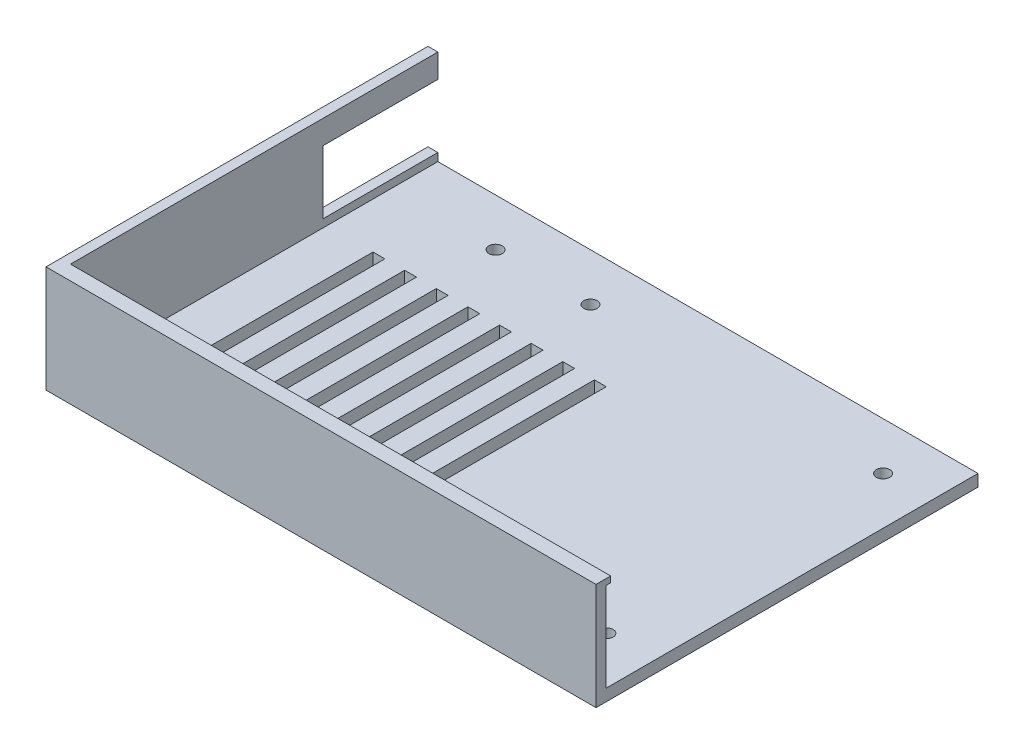
from build123d import *

# Parameters (mm, degrees)
SKETCH1_W                     = 278.2
SKETCH1_H                     = 193.2
SHELL_BLOCK_DEPTH             = 27
SKETCH2_W                     = 273.2
SKETCH2_H                     = 185.8
FRONT_OPENING_DEPTH           = 1.5
SKETCH3_W                     = 273.2
SKETCH3_H                     = 188.2
DISPLAY_POCKET_DEPTH          = 22.5
SKETCH4_W                     = 3
SKETCH4_H                     = 56
VENT_SLOTS_DEPTH              = 4
SKETCH5_W                     = 58
SKETCH5_H                     = 16
CABLE_EXIT_X_SHORT_SIDE_DEPTH = 140.1
SKETCH6_R                     = 1.7
BOLT_HOLES_DEPTH              = 4
KEEP_ONE_HALF_X_DEPTH         = 172.491603293
KEEP_ONE_HALF_X_DEPTH_BACK    = 172.491603293
SKETCH7_W                     = 200
SKETCH7_H                     = 400
KEEP_ONE_QUARTER_Z_DEPTH      = 172.491603293
KEEP_ONE_QUARTER_Z_DEPTH_BACK = 172.491603293
SKETCH8_W                     = 400
SKETCH8_H                     = 200


with BuildPart() as part:
    # Sketch1 → Shell Block (new body)
    with BuildSketch(Plane(origin=(0, 0, 0), x_dir=(1, 0, 0), z_dir=(0, 1, 0))):
        Rectangle(SKETCH1_W, SKETCH1_H)
    extrude(amount=SHELL_BLOCK_DEPTH)

    # Sketch2 → Front Opening (cut)
    with BuildSketch(Plane(origin=(0, 27, 0), x_dir=(1, 0, 0), z_dir=(0, 1, 0))):
        Rectangle(SKETCH2_W, SKETCH2_H)
    extrude(amount=-FRONT_OPENING_DEPTH, mode=Mode.SUBTRACT)

    # Sketch3 → Display Pocket (cut)
    with BuildSketch(Plane(origin=(0, 25.5, 0), x_dir=(1, 0, 0), z_dir=(0, 1, 0))):
        Rectangle(SKETCH3_W, SKETCH3_H)
    extrude(amount=-DISPLAY_POCKET_DEPTH, mode=Mode.SUBTRACT)

    # Sketch4 → Vent Slots (cut)
    with BuildSketch(Plane(origin=(0, 3, 0), x_dir=(1, 0, 0), z_dir=(0, 1, 0))):
        with Locations((-67.5, 56)):
            Rectangle(SKETCH4_W, SKETCH4_H)
        with Locations((-67.5, -56)):
            Rectangle(SKETCH4_W, SKETCH4_H)
        with Locations((-75.5, 56)):
            Rectangle(SKETCH4_W, SKETCH4_H)
        with Locations((-75.5, -56)):
            Rectangle(SKETCH4_W, SKETCH4_H)
        with Locations((-83.5, 56)):
            Rectangle(SKETCH4_W, SKETCH4_H)
        with Locations((-83.5, -56)):
            Rectangle(SKETCH4_W, SKETCH4_H)
        with Locations((-91.5, 56)):
            Rectangle(SKETCH4_W, SKETCH4_H)
        with Locations((-91.5, -56)):
            Rectangle(SKETCH4_W, SKETCH4_H)
        with Locations((-99.5, 56)):
            Rectangle(SKETCH4_W, SKETCH4_H)
        with Locations((-99.5, -56)):
            Rectangle(SKETCH4_W, SKETCH4_H)
        with Locations((-107.5, 56)):
            Rectangle(SKETCH4_W, SKETCH4_H)
        with Locations((-107.5, -56)):
            Rectangle(SKETCH4_W, SKETCH4_H)
        with Locations((-115.5, 56)):
            Rectangle(SKETCH4_W, SKETCH4_H)
        with Locations((-115.5, -56)):
            Rectangle(SKETCH4_W, SKETCH4_H)
        with Locations((-123.5, 56)):
            Rectangle(SKETCH4_W, SKETCH4_H)
        with Locations((-123.5, -56)):
            Rectangle(SKETCH4_W, SKETCH4_H)
    extrude(amount=-VENT_SLOTS_DEPTH, mode=Mode.SUBTRACT)

    # Sketch5 → Cable Exit (-X short side) (cut)
    with BuildSketch(Plane(origin=(0, 0, 0), x_dir=(0, 0, -1), z_dir=(1, 0, 0))):
        with Locations((0, 13)):
            Rectangle(SKETCH5_W, SKETCH5_H)
    extrude(amount=-CABLE_EXIT_X_SHORT_SIDE_DEPTH, mode=Mode.SUBTRACT)

    # Sketch6 → Bolt Holes (cut)
    with BuildSketch(Plane(origin=(0, 3, 0), x_dir=(1, 0, 0), z_dir=(0, 1, 0))):
        with Locations((-40, 18)):
            Circle(SKETCH6_R)
        with Locations((-40, 88)):
            Circle(SKETCH6_R)
        with Locations((40, 18)):
            Circle(SKETCH6_R)
        with Locations((40, 88)):
            Circle(SKETCH6_R)
        with Locations((-52, 40)):
            Circle(SKETCH6_R)
        with Locations((-52, 66)):
            Circle(SKETCH6_R)
        with Locations((52, 40)):
            Circle(SKETCH6_R)
        with Locations((52, 66)):
            Circle(SKETCH6_R)
        with Locations((-12, -82)):
            Circle(SKETCH6_R)
        with Locations((12, -82)):
            Circle(SKETCH6_R)
        with Locations((124, -12)):
            Circle(SKETCH6_R)
        with Locations((124, 12)):
            Circle(SKETCH6_R)
        with Locations((-12, -12)):
            Circle(SKETCH6_R)
        with Locations((-12, 12)):
            Circle(SKETCH6_R)
        with Locations((12, -12)):
            Circle(SKETCH6_R)
        with Locations((12, 12)):
            Circle(SKETCH6_R)
        with Locations((-110, 12)):
            Circle(SKETCH6_R)
        with Locations((-110, -12)):
            Circle(SKETCH6_R)
        with Locations((-86, 12)):
            Circle(SKETCH6_R)
        with Locations((-86, -12)):
            Circle(SKETCH6_R)
    extrude(amount=-BOLT_HOLES_DEPTH, mode=Mode.SUBTRACT)

    # Sketch7 → Keep one half (X) (cut, two sides: drawn at the far end of the back side and taken through both)
    with BuildSketch(Plane(origin=(0, 0, 0), x_dir=(1, 0, 0), z_dir=(0, 1, 0)).offset(-KEEP_ONE_HALF_X_DEPTH_BACK)):
        with Locations((100, 0)):
            Rectangle(SKETCH7_W, SKETCH7_H)
    extrude(amount=KEEP_ONE_HALF_X_DEPTH + KEEP_ONE_HALF_X_DEPTH_BACK, mode=Mode.SUBTRACT)

    # Sketch8 → Keep one quarter (Z) (cut, two sides: drawn at the far end of the back side and taken through both)
    with BuildSketch(Plane(origin=(0, 0, 0), x_dir=(1, 0, 0), z_dir=(0, 1, 0)).offset(-KEEP_ONE_QUARTER_Z_DEPTH_BACK)):
        with Locations((0, 100)):
            Rectangle(SKETCH8_W, SKETCH8_H)
    extrude(amount=KEEP_ONE_QUARTER_Z_DEPTH + KEEP_ONE_QUARTER_Z_DEPTH_BACK, mode=Mode.SUBTRACT)


solid = part.part
